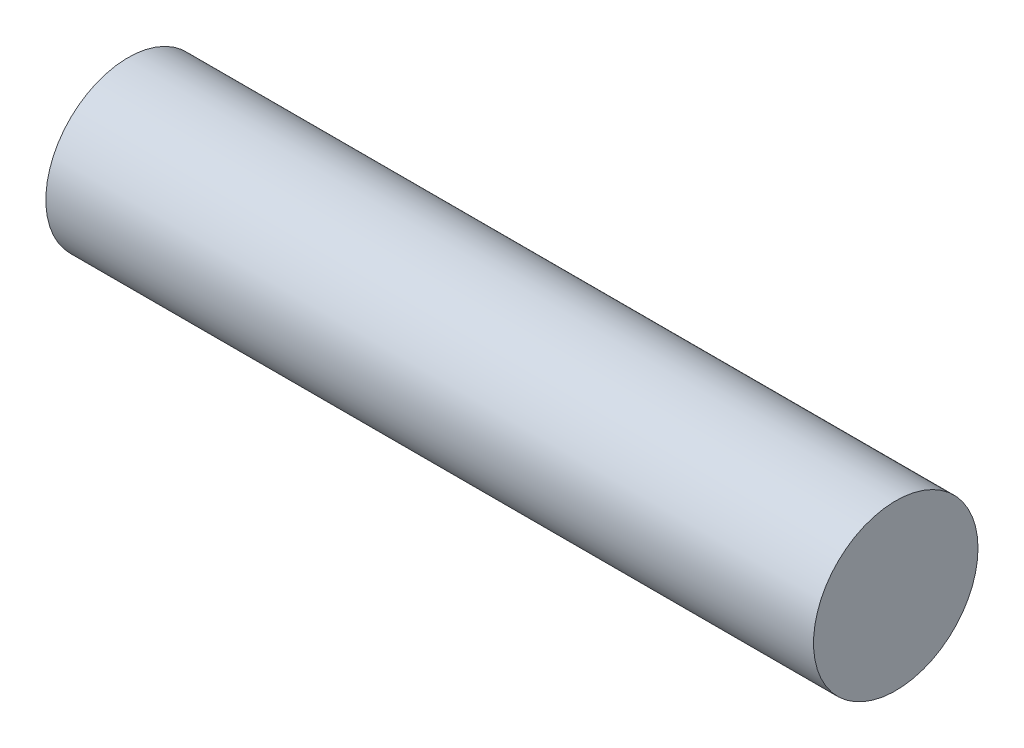
from build123d import *

# Parameters (mm, degrees)
SKETCH1_R           = 9.525
BOSS_EXTRUDE1_DEPTH = 88.9


with BuildPart() as part:
    # Sketch1 → Boss-Extrude1 (new body)
    with BuildSketch(Plane(origin=(0, 0, 0), x_dir=(0, 0, -1), z_dir=(1, 0, 0))):
        Circle(SKETCH1_R)
    extrude(amount=BOSS_EXTRUDE1_DEPTH)


solid = part.part
